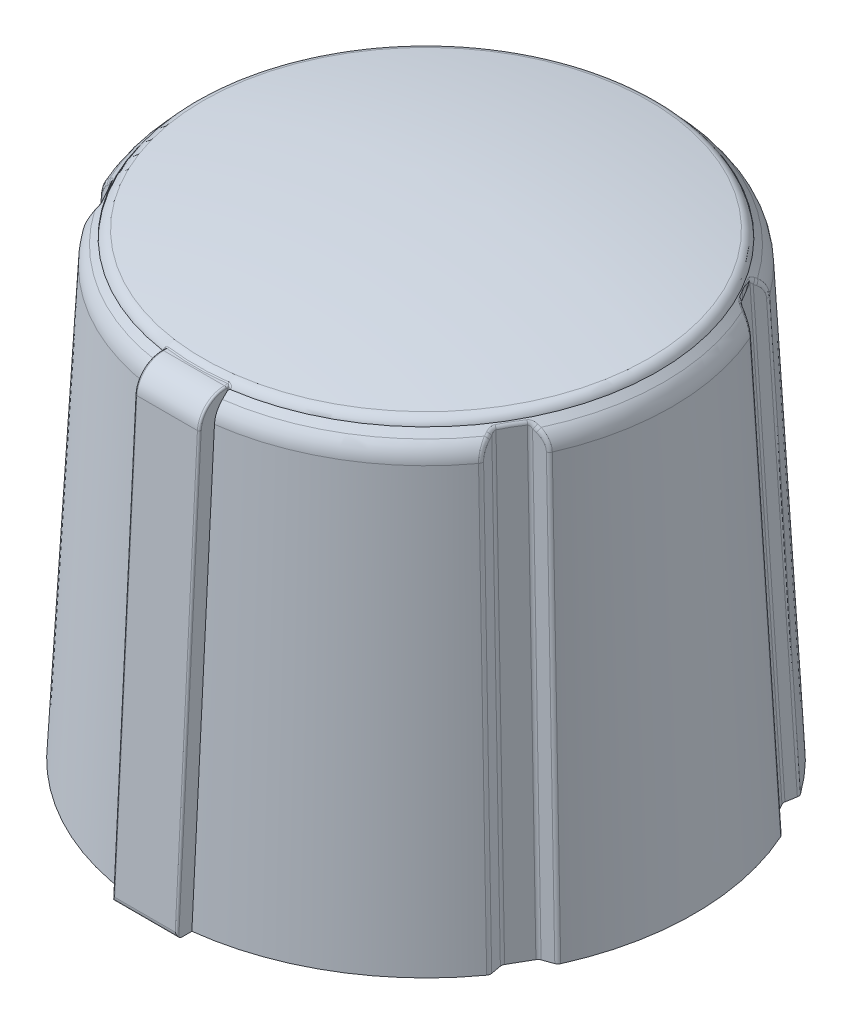
from build123d import *

# Parameters (mm, degrees)
CUT_EXTRUDE2_DEPTH                   = 22.948799825
FILLET1_R                            = 0.1994
CIRPATTERN1_COUNT                    = 6
FILLET1_OF_CIRPATTERN1_R             = 0.1994
SKETCH14_R                           = 8.616801353
CUT_EXTRUDE4_DEPTH                   = 22.894671915
CUT_EXTRUDE4_DRAFT                   = 1.5
FILLET2_R                            = 0.4
SKETCH15_W                           = 2.3928
SKETCH15_H                           = 9.97
CUT_EXTRUDE5_DEPTH                   = 23.670171038
SKETCH16_W                           = 2.3928
SKETCH16_H                           = 9.5712
BOSS_EXTRUDE2_DEPTH                  = 16.891
DRAFT1_ANGLE                         = 3
FILLET5_R                            = 1
FILLET6_R                            = 0.07
FILLET7_R                            = 0.08
FILLET9_R                            = 0.2
CUT_EXTRUDE3_DEPTH                   = 15.24
SKETCH17_R                           = 7.94
CUT_EXTRUDE6_DEPTH                   = 2.54
BOSS_EXTRUDE3_REACH                  = 18.957
BOSS_EXTRUDE3_END_RADIUS             = 3
BOSS_EXTRUDE3_DIRECTION_2_REACH      = 18.957
BOSS_EXTRUDE3_DIRECTION_2_END_RADIUS = 3
FILLET8_R                            = 0.05
FILLET10_R                           = 0.4
FILLET11_R                           = 0.2


with BuildPart() as part:
    # Sketch3 → Revolve1 (revolve)
    with BuildSketch(Plane.XY):
        with BuildLine():
            Line((-9.97, -8.89), (0, -8.89))
            Line((0, -8.89), (0, 7.89))
            Line((0, 7.89), (-8.616801353, 7.89))
            Line((-8.616801353, 7.89), (-8.845368491, 7.661432862))
            ThreePointArc((-8.845368491, 7.661432862), (-9.051807168, 7.361062724), (-9.136891245, 7.006662037))
            Line((-9.136891245, 7.006662037), (-9.97, -8.89))
        make_face()
    revolve(axis=Axis((0, 8.89, 0), (0, -1, 0)))

    # Sketch7 → Cut-Extrude2 (cut, through all, along a direction that is not the sketch's normal)
    with BuildSketch(Plane.XZ.offset(8.89)):
        with BuildLine():
            Line((0.4985, 9.5712), (-0.4985, 9.5712))
            Line((-0.4985, 9.5712), (-0.92277002, 9.927204818))
            ThreePointArc((-0.92277002, 9.927204818), (0, 9.97), (0.92277002, 9.927204818))
            Line((0.92277002, 9.927204818), (0.4985, 9.5712))
        make_face()
    cut_extrude2 = extrude(amount=-CUT_EXTRUDE2_DEPTH, dir=(0, -0.9986295347545743, 0.052335956242936764), mode=Mode.SUBTRACT)

    # Fillet1
    fillet1_edges = [part.edges().sort_by_distance(p)[0] for p in [
        (-0.920767365, -0.941665335, 9.508969822),
        (0.920767365, -0.941665335, 9.508969822),
        (-0.839567031, 7.37848831, 9.004793875),
        (0.839567031, 7.37848831, 9.004793875),
        (0.4985, -0.547104384, 9.133967368),
        (-0.4985, -0.547104384, 9.133967368),
        (0, 7.810856135, 8.695945218),
        (-0.569170294, 7.728783415, 8.759545884),
        (0.569170294, 7.728783415, 8.759545884),
    ]]
    fillet(fillet1_edges, radius=FILLET1_R)

    # CirPattern1: Cut-Extrude2 ×6 about axis
    cirpattern1_axis = Axis((0, 0, 0), (0, -1, 0))
    for i in range(1, CIRPATTERN1_COUNT):
        add(cut_extrude2.rotate(cirpattern1_axis, i * 360 / CIRPATTERN1_COUNT), mode=Mode.SUBTRACT)

    # Fillet1 of CirPattern1
    fillet1_of_cirpattern1_edges = [part.edges().sort_by_distance(p)[0] for p in [
        (-8.695393112, -0.941665335, 3.957076982),
        (-7.774625747, -0.941665335, 5.55189284),
        (-8.218163767, 7.37848831, 3.775310561),
        (-7.378596736, 7.37848831, 5.229483314),
        (-7.660997778, -0.547104384, 4.998697348),
        (-8.159497778, -0.547104384, 4.13527002),
        (-7.530909469, 7.810856135, 4.347972609),
        (-7.870574408, 7.728783415, 3.886857009),
        (-7.301404114, 7.728783415, 4.872688876),
        (-7.774625747, -0.941665335, -5.55189284),
        (-8.695393112, -0.941665335, -3.957076982),
        (-7.378596736, 7.37848831, -5.229483314),
        (-8.218163767, 7.37848831, -3.775310561),
        (-8.159497778, -0.547104384, -4.13527002),
        (-7.660997778, -0.547104384, -4.998697348),
        (-7.530909469, 7.810856135, -4.347972609),
        (-7.301404114, 7.728783415, -4.872688876),
        (-7.870574408, 7.728783415, -3.886857009),
        (0.920767365, -0.941665335, -9.508969822),
        (-0.920767365, -0.941665335, -9.508969822),
        (0.839567031, 7.37848831, -9.004793875),
        (-0.839567031, 7.37848831, -9.004793875),
        (-0.4985, -0.547104384, -9.133967368),
        (0.4985, -0.547104384, -9.133967368),
        (0, 7.810856135, -8.695945218),
        (0.569170294, 7.728783415, -8.759545884),
        (-0.569170294, 7.728783415, -8.759545884),
        (8.695393112, -0.941665335, -3.957076982),
        (7.774625747, -0.941665335, -5.55189284),
        (8.218163767, 7.37848831, -3.775310561),
        (7.378596736, 7.37848831, -5.229483314),
        (7.660997778, -0.547104384, -4.998697348),
        (8.159497778, -0.547104384, -4.13527002),
        (7.530909469, 7.810856135, -4.347972609),
        (7.870574408, 7.728783415, -3.886857009),
        (7.301404114, 7.728783415, -4.872688876),
        (7.774625747, -0.941665335, 5.55189284),
        (8.695393112, -0.941665335, 3.957076982),
        (7.378596736, 7.37848831, 5.229483314),
        (8.218163767, 7.37848831, 3.775310561),
        (8.159497778, -0.547104384, 4.13527002),
        (7.660997778, -0.547104384, 4.998697348),
        (7.530909469, 7.810856135, 4.347972609),
        (7.301404114, 7.728783415, 4.872688876),
        (7.870574408, 7.728783415, 3.886857009),
    ]]
    fillet(fillet1_of_cirpattern1_edges, radius=FILLET1_OF_CIRPATTERN1_R)


with BuildPart() as cut_extrude4_tool:
    # Sketch14 → Cut-Extrude4 (with draft: the straight prism first)
    with BuildSketch(Plane(origin=(0, 7.89, 0), x_dir=(1, 0, 0), z_dir=(0, 1, 0))):
        Circle(SKETCH14_R)
    extrude(amount=-CUT_EXTRUDE4_DEPTH)
    # Cut-Extrude4: the draft: its side faces are tilted about the plane it starts from
    cut_extrude4_sides = [cut_extrude4_tool.faces().sort_by_distance(p)[0] for p in [
        (-8.616801353, -3.557335958, 0),
    ]]
    draft(cut_extrude4_sides, Plane(origin=(0, 7.89, 0), x_dir=(1, 0, 0), z_dir=(0, 1, 0)), CUT_EXTRUDE4_DRAFT)


with BuildPart() as part_1:
    add(part.part)

    # Cut-Extrude4: cut by cut_extrude4_tool
    add(cut_extrude4_tool.part, mode=Mode.SUBTRACT)

    # Sketch15 → Cut-Extrude5 (cut, through all)
    with BuildSketch(Plane.XZ.offset(8.89)):
        with Locations((0, 4.985)):
            Rectangle(SKETCH15_W, SKETCH15_H)
    extrude(amount=-CUT_EXTRUDE5_DEPTH, mode=Mode.SUBTRACT)

    # Fillet7
    fillet7_edges = [part_1.edges().sort_by_distance(p)[0] for p in [
        (-1.1964, -0.49999864, 8.755134522),
        (1.1964, -0.49999864, 8.755134522),
    ]]
    fillet(fillet7_edges, radius=FILLET7_R)


with BuildPart() as body_2:
    # Sketch8 → Revolve2 (revolve)
    with BuildSketch(Plane.XY, mode=Mode.PRIVATE) as revolve2_sk:
        with BuildLine():
            Line((0, 8.89), (0, -8.89))
            Line((0, -8.89), (9.056201117, -8.89))
            Line((9.056201117, -8.89), (8.616801353, 7.89))
            Line((8.616801353, 7.89), (8.616801353, 8.09))
            ThreePointArc((8.616801353, 8.09), (4.32692921, 8.689570867), (0, 8.89))
        make_face()
    revolve(revolve2_sk.sketch.rotate(Axis((0, 8.89, 0), (0, -1, 0)), 90), axis=Axis((0, 8.89, 0), (0, -1, 0)))

    # Fillet2
    fillet2_edges = [body_2.edges().sort_by_distance(p)[0] for p in [
        (0, 8.09, -8.616801353),
    ]]
    fillet(fillet2_edges, radius=FILLET2_R)

    # Sketch16 → Boss-Extrude2 (add)
    with BuildSketch(Plane.XZ.offset(8.89)):
        with Locations((0, 4.7856)):
            Rectangle(SKETCH16_W, SKETCH16_H)
    extrude(amount=-BOSS_EXTRUDE2_DEPTH)

    # Draft1
    draft1_faces = [body_2.faces().sort_by_distance(p)[0] for p in [
        (0, -0.4445, 9.5712),
    ]]
    draft(draft1_faces, Plane.ZX.offset(8.001), DRAFT1_ANGLE)

    # Fillet5
    fillet5_edges = [body_2.edges().sort_by_distance(p)[0] for p in [
        (0, 8.001, 9.5712),
    ]]
    fillet(fillet5_edges, radius=FILLET5_R)

    # Fillet6
    fillet6_edges = [body_2.edges().sort_by_distance(p)[0] for p in [
        (0.59968141, 8.001, 8.515386919),
        (1.1964, 7.890588013, 8.513250242),
        (-1.1964, 7.890588013, 8.513250242),
        (1.1964, 8.001, 8.537230536),
        (-1.1964, -0.561687932, 8.756764923),
        (1.1964, -0.561687932, 8.756764923),
        (1.1964, -0.918332022, 10.038642384),
        (-1.1964, -0.918332022, 10.038642384),
        (-1.1964, 8.001, 8.537230536),
        (-1.1964, 7.726374371, 9.310590009),
        (1.1964, 7.726374371, 9.310590009),
    ]]
    fillet(fillet6_edges, radius=FILLET6_R)

    # Fillet9
    # the kernel refuses this fillet: 0.2 mm, written as the material it takes off along each edge
    with BuildSketch(Plane(origin=(-1.653290063, -8.89, 10.4564198), x_dir=(0, 0.9986295347545736, -0.05233595624294668), z_dir=(1, 0, 0))) as fillet9_piece_1:
        with BuildLine():
            CenterArc((FILLET9_R * 1.05378012528, -FILLET9_R), FILLET9_R, 90, 93)
            Line((FILLET9_R * 0.0551505905264, -FILLET9_R * 1.05233595624), (0, 0))
            Line((0, 0), (FILLET9_R * 1.05378012528, 0))
        make_face()
    extrude(amount=3.306580125, mode=Mode.SUBTRACT)

    # Sketch13 → Cut-Extrude3 (cut)
    with BuildSketch(Plane.XZ.offset(8.89)):
        with BuildLine():
            Line((-2.598076211, -1.5), (2.598076211, -1.5))
            ThreePointArc((2.598076211, -1.5), (0, 3), (-2.598076211, -1.5))
        make_face()
    extrude(amount=-CUT_EXTRUDE3_DEPTH, mode=Mode.SUBTRACT)

    # Sketch17 → Cut-Extrude6 (cut)
    with BuildSketch(Plane.XZ.offset(8.89)):
        Circle(SKETCH17_R)
    extrude(amount=-CUT_EXTRUDE6_DEPTH, mode=Mode.SUBTRACT)

    # Boss-Extrude3: up to this cylinder (the profile starts inside it)
    boss_extrude3_end = Plane(origin=(0, -3.81, 0), z_dir=(0, -1, 0)) * Cylinder(BOSS_EXTRUDE3_END_RADIUS, 44.914, mode=Mode.PRIVATE)
    # Sketch6 → Boss-Extrude3 (add, up to the surface)
    with BuildSketch(Plane(origin=(0, 0, 0), x_dir=(0, 0, -1), z_dir=(1, 0, 0)), mode=Mode.PRIVATE) as boss_extrude3_sk1:
        with BuildLine():
            Line((1.5, -3.371251781), (1.5, -4.248748219))
            ThreePointArc((1.5, -4.248748219), (1.25, -3.81), (1.5, -3.371251781))
        make_face()
    boss_extrude3_tool1 = extrude(boss_extrude3_sk1.sketch, amount=-BOSS_EXTRUDE3_REACH, mode=Mode.PRIVATE) & boss_extrude3_end
    add(boss_extrude3_tool1.solids().sort_by_distance((0, -3.81, -1.397547))[0])

    # Boss-Extrude3 direction 2: up to this cylinder (the profile starts inside it)
    boss_extrude3_direction_2_end = Plane(origin=(0, -3.81, 0), z_dir=(0, -1, 0)) * Cylinder(BOSS_EXTRUDE3_DIRECTION_2_END_RADIUS, 44.914, mode=Mode.PRIVATE)
    # Sketch6 → Boss-Extrude3 direction 2 (add, up to the surface)
    with BuildSketch(Plane(origin=(0, 0, 0), x_dir=(0, 0, -1), z_dir=(1, 0, 0)), mode=Mode.PRIVATE) as boss_extrude3_direction_2_sk1:
        with BuildLine():
            Line((1.5, -3.371251781), (1.5, -4.248748219))
            ThreePointArc((1.5, -4.248748219), (1.25, -3.81), (1.5, -3.371251781))
        make_face()
    boss_extrude3_direction_2_tool1 = extrude(boss_extrude3_direction_2_sk1.sketch, amount=BOSS_EXTRUDE3_DIRECTION_2_REACH, mode=Mode.PRIVATE) & boss_extrude3_direction_2_end
    add(boss_extrude3_direction_2_tool1.solids().sort_by_distance((0, -3.81, -1.397547))[0])

    # Fillet8
    fillet8_edges = [body_2.edges().sort_by_distance(p)[0] for p in [
        (-2.727178029, -3.81, -1.25),
        (0, -4.248748219, -1.5),
        (2.727178029, -3.81, -1.25),
    ]]
    fillet(fillet8_edges, radius=FILLET8_R)

    # Fillet10
    fillet10_edges = [body_2.edges().sort_by_distance(p)[0] for p in [
        (-7.94, -8.89, 0),
        (-7.94, -6.35, 0),
    ]]
    fillet(fillet10_edges, radius=FILLET10_R)

    # Fillet11
    fillet11_edges = [body_2.edges().sort_by_distance(p)[0] for p in [
        (0, -6.35, -1.5),
        (0, -6.35, 3),
    ]]
    fillet(fillet11_edges, radius=FILLET11_R)


solid = Compound([part_1.part, body_2.part])
